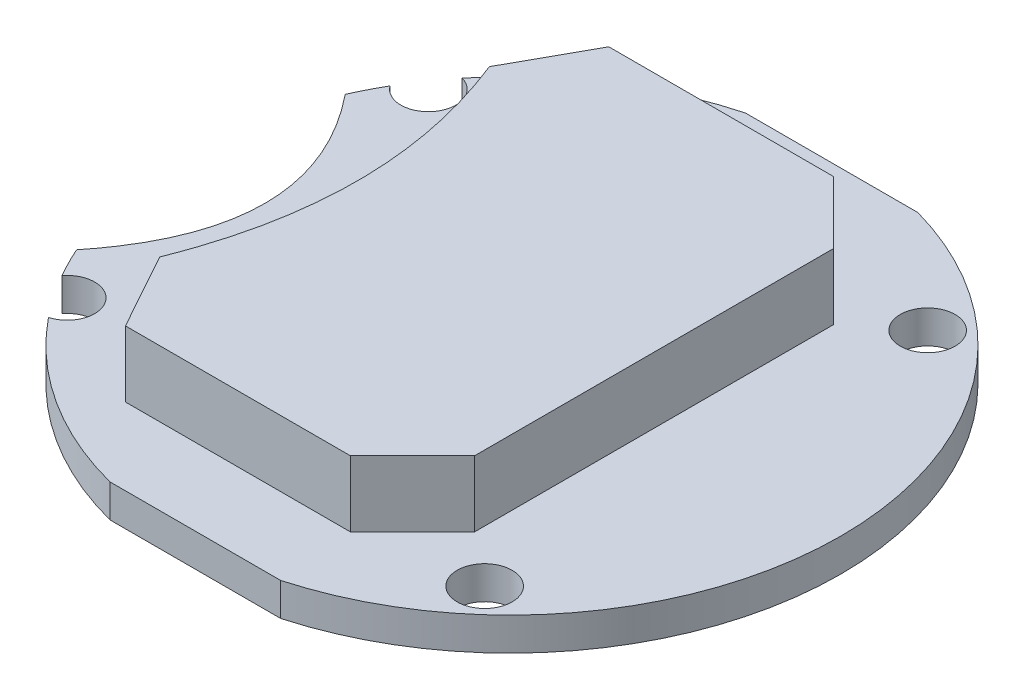
from build123d import *

# Parameters (mm, degrees)
EXTRUDE_1_DEPTH     = 1.5
EXTRUDE_2_DEPTH     = 3
SKETCH_5_R          = 1.25
CUT_EXTRUDE_2_DEPTH = 22.798734891
CUT_EXTRUDE_3_DEPTH = 22.798734891


with BuildPart() as part:
    # Эскиз1 → Бобышка-Вытянуть1 (new body)
    with BuildSketch(Plane(origin=(0, 0, 0), x_dir=(1, 0, 0), z_dir=(0, 1, 0))):
        with BuildLine():
            Line((5, 14.5), (-5, 14.5))
            ThreePointArc((-5, 14.5), (-9.453000697, 12.420644275), (-13, 9.018919508))
            Line((-13, 9.018919508), (-13, 6.5))
            add(Edge.make_bspline(
                [(-13, 6.5), (-7.441418368, 0), (-13, -6.5)],
                knots=[0, 0, 0, 1, 1, 1], degree=2))
            Line((-13, -6.5), (-13, -9.018919508))
            ThreePointArc((-13, -9.018919508), (-9.453000697, -12.420644275), (-5, -14.5))
            Line((-5, -14.5), (5, -14.5))
            ThreePointArc((5, -14.5), (15.997963501, 0), (5, 14.5))
        make_face()
    extrude(amount=EXTRUDE_1_DEPTH)

    # Эскиз3 → Бобышка-Вытянуть2 (add)
    with BuildSketch(Plane(origin=(0, 1.5, 0), x_dir=(1, 0, 0), z_dir=(0, 1, 0))):
        with BuildLine():
            Line((4.668952027, -11), (7.497379152, -8.171572875))
            Line((7.497379152, -8.171572875), (7.497379152, 8.171572875))
            Line((7.497379152, 8.171572875), (4.668952027, 11))
            Line((4.668952027, 11), (-5.566129175, 11))
            Line((-5.566129175, 11), (-7.502620848, 7.5))
            add(Edge.make_bspline(
                [(-7.502620848, 7.5), (-4.502620848, 0), (-7.502620848, -7.5)],
                knots=[0, 0, 0, 1, 1, 1], degree=2))
            Line((-7.502620848, -7.5), (-5.566129175, -11))
            Line((-5.566129175, -11), (4.668952027, -11))
        make_face()
    extrude(amount=EXTRUDE_2_DEPTH)

    # Эскиз5 → Вырез-Вытянуть2 (cut, through all)
    with BuildSketch(Plane(origin=(0, 1.5, 0), x_dir=(1, 0, 0), z_dir=(0, 1, 0))):
        with Locations((9.863113254, 10.081034519)):
            Circle(SKETCH_5_R)
        with Locations((-10.997789514, 8.218757238)):
            Circle(SKETCH_5_R)
        with Locations((9.863113254, -10.081034519)):
            Circle(SKETCH_5_R)
        with Locations((-10.997789514, -8.218757238)):
            Circle(SKETCH_5_R)
    extrude(amount=-CUT_EXTRUDE_2_DEPTH, mode=Mode.SUBTRACT)

    # Эскиз7 → Вырез-Вытянуть3 (cut, through all)
    with BuildSketch(Plane(origin=(0, 1.5, 0), x_dir=(1, 0, 0), z_dir=(0, 1, 0))):
        with BuildLine():
            Line((-13, 9.018919508), (-13, 6.5))
            Line((-13, 6.5), (-12.715649732, 6.077566297))
            ThreePointArc((-12.715649732, 6.077566297), (-8.737112762, 11.411761045), (-2.842609373, 14.5))
            Line((-2.842609373, 14.5), (-5, 14.5))
            ThreePointArc((-5, 14.5), (-9.453000697, 12.420644275), (-13, 9.018919508))
        make_face()
        with BuildLine():
            Line((-13, -6.5), (-13, -9.018919508))
            ThreePointArc((-13, -9.018919508), (-9.453000697, -12.420644275), (-5, -14.5))
            Line((-5, -14.5), (-2.763931787, -14.5))
            ThreePointArc((-2.763931787, -14.5), (-8.693434445, -11.422725682), (-12.695530111, -6.07372117))
            Line((-12.695530111, -6.07372117), (-13, -6.5))
        make_face()
    extrude(amount=-CUT_EXTRUDE_3_DEPTH, mode=Mode.SUBTRACT)


solid = part.part
